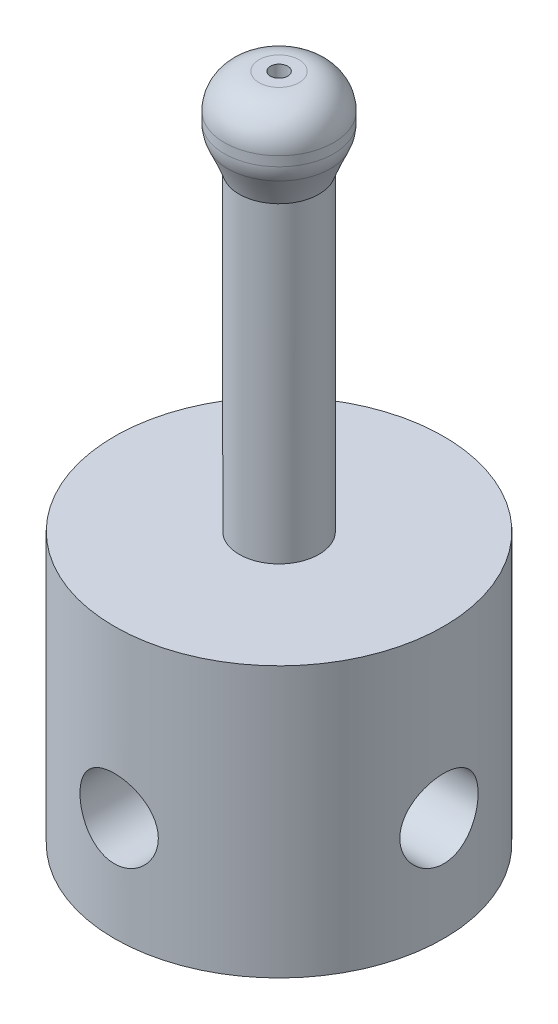
from build123d import *

# Parameters (mm, degrees)
SKETCH1_R           = 12.065
BOSS_EXTRUDE1_DEPTH = 19.812
SKETCH2_R           = 2.921
BOSS_EXTRUDE2_DEPTH = 25.4
SKETCH3_R           = 4.0005
BOSS_EXTRUDE3_DEPTH = 3.81
FILLET3_R           = 2.54
SKETCH7_R           = 2.8702
CUT_EXTRUDE1_DEPTH  = 12.7
CIRPATTERN1_COUNT   = 2
CIRPATTERN1_ANGLE   = 90
FILLET4_R           = 2.54
CUT_EXTRUDE2_REACH  = 53.907
SKETCH9_R           = 0.635


with BuildPart() as part:
    # Sketch1 → Boss-Extrude1 (new body)
    with BuildSketch(Plane(origin=(0, 0, 0), x_dir=(1, 0, 0), z_dir=(0, 1, 0))):
        with Locations(Location((0, 0, 0), (0, 0, 270))):
            Circle(SKETCH1_R)
    extrude(amount=BOSS_EXTRUDE1_DEPTH)

    # Sketch2 → Boss-Extrude2 (add)
    with BuildSketch(Plane(origin=(0, 19.812, 0), x_dir=(1, 0, 0), z_dir=(0, 1, 0))):
        with Locations(Location((0, 0, 0), (0, 0, 270))):
            Circle(SKETCH2_R)
    extrude(amount=BOSS_EXTRUDE2_DEPTH)

    # Sketch3 → Boss-Extrude3 (add)
    with BuildSketch(Plane(origin=(0, 45.212, 0), x_dir=(1, 0, 0), z_dir=(0, 1, 0))):
        with Locations(Location((0, 0, 0), (0, 0, 90))):
            Circle(SKETCH3_R)
    extrude(amount=BOSS_EXTRUDE3_DEPTH)

    # Fillet3
    fillet3_edges = [part.edges().sort_by_distance(p)[0] for p in [
        (0, 49.022, 4.0005),
    ]]
    fillet(fillet3_edges, radius=FILLET3_R)

    # Sketch7 → Cut-Extrude1 (cut, symmetric)
    with BuildSketch(Plane.XY):
        with Locations(Location((0, 7.62, 0), (0, 0, 90.000000025))):
            Circle(SKETCH7_R)
    cut_extrude1 = extrude(amount=CUT_EXTRUDE1_DEPTH, both=True, mode=Mode.SUBTRACT)

    # CirPattern1: Cut-Extrude1 ×2 about axis
    cirpattern1_axis = Axis((0, 45.212, 0), (0, -1, 0))
    for i in range(1, CIRPATTERN1_COUNT):
        add(cut_extrude1.rotate(cirpattern1_axis, i * CIRPATTERN1_ANGLE / (CIRPATTERN1_COUNT - 1)), mode=Mode.SUBTRACT)

    # Loft1: read off the stored shape, not the designer's step
    # Loft1: loft between two sections, ruled curve by curve
    loft1_from = [
        Edge.make_bspline([(4.000436037, 45.212, 0.022622174), (3.955191689, 45.212, 8.023494248), (-4.045680385, 45.212, 7.9782499), (-4.000436037, 45.212, -0.022622174), (-3.955191689, 45.212, -8.023494248), (4.045680385, 45.212, -7.9782499), (4.000436037, 45.212, 0.022622174)], [0, 0, 0, 0, 0.5, 0.5, 0.5, 1, 1, 1, 1], 3, [1, 0.333333333, 0.333333333, 1, 0.333333333, 0.333333333, 1]),
    ]
    loft1_to = [
        Edge.make_bspline([(2.781979214, 42.672, 0.890411509), (1.001156196, 42.672, 6.454369936), (-4.562802231, 42.672, 4.673546919), (-2.781979214, 42.672, -0.890411509), (-1.001156196, 42.672, -6.454369936), (4.562802231, 42.672, -4.673546919), (2.781979214, 42.672, 0.890411509)], [0, 0, 0, 0, 0.5, 0.5, 0.5, 1, 1, 1, 1], 3, [1, 0.333333333, 0.333333333, 1, 0.333333333, 0.333333333, 1]),
    ]
    loft1 = Solid(Shell([*[Face.make_surface_from_curves(loft1_from[k], loft1_to[k]) for k in range(1)], Face(Wire(loft1_from)), Face(Wire(loft1_to))]))
    add(loft1)

    # Fillet4
    fillet4_edges = [part.edges().sort_by_distance(p)[0] for p in [
        (-2.836767549, 45.212, 2.820771193),
    ]]
    fillet(fillet4_edges, radius=FILLET4_R)

    # Cut-Extrude2: up to this face of the body (flat: up to its plane)
    cut_extrude2_end = Plane(part.part.faces().sort_by_distance((0, 0, 0))[0])
    # Sketch9 → Cut-Extrude2 (cut, up to the picked face)
    with BuildSketch(Plane(origin=(0, 49.022, 0), x_dir=(1, 0, 0), z_dir=(0, 1, 0)), mode=Mode.PRIVATE) as cut_extrude2_sk1:
        with Locations(Location((0, 0, 0), (0, 0, 270))):
            Circle(SKETCH9_R)
    cut_extrude2_tool1 = split(extrude(cut_extrude2_sk1.sketch, amount=-CUT_EXTRUDE2_REACH, mode=Mode.PRIVATE), bisect_by=cut_extrude2_end, keep=Keep.BOTH, mode=Mode.PRIVATE)
    add(cut_extrude2_tool1.solids().sort_by(Axis((0, 49.022, 0), (0, -1, 0)))[0], mode=Mode.SUBTRACT)


solid = part.part
